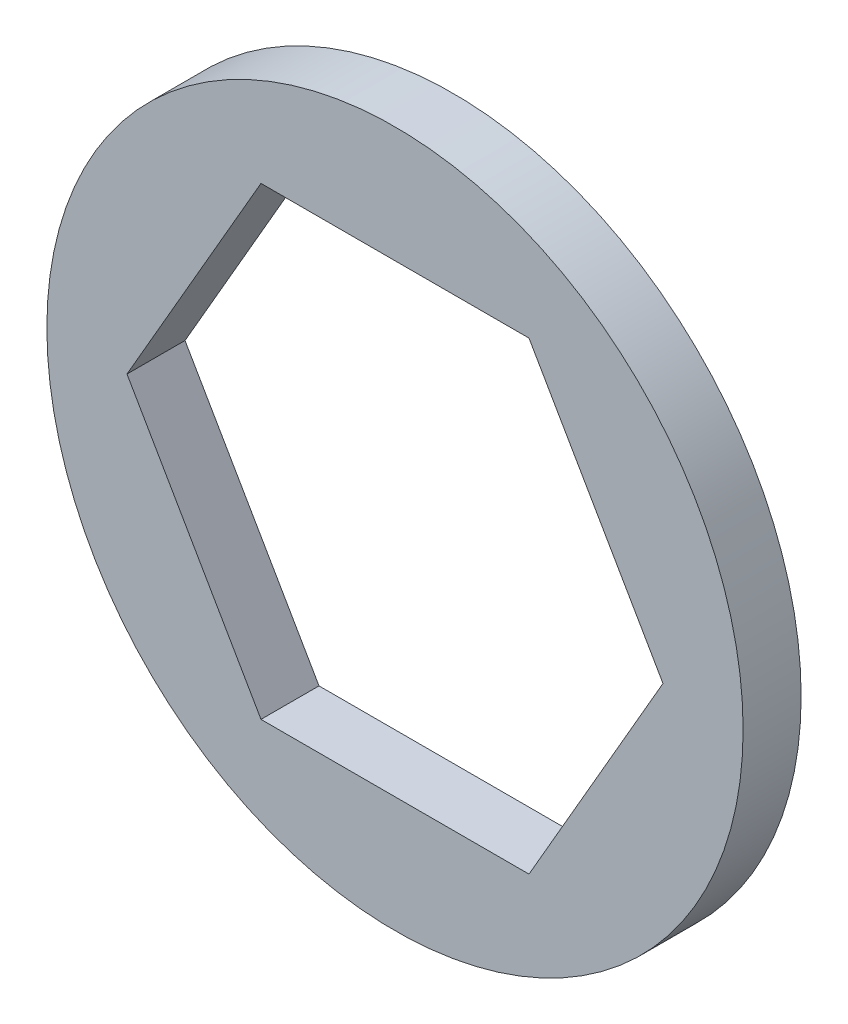
from build123d import *

# Parameters (mm, degrees)
SKETCH1_R           = 9.525
BOSS_EXTRUDE1_DEPTH = 1.5875


with BuildPart() as part:
    # Sketch1 → Boss-Extrude1 (new body)
    with BuildSketch(Plane.XY):
        Circle(SKETCH1_R)
        Polygon((3.666174209, 6.35), (-3.666174209, 6.35), (-7.332348419, 0), (-3.666174209, -6.35), (3.666174209, -6.35), (7.332348419, 0), align=None, mode=Mode.SUBTRACT)
    extrude(amount=BOSS_EXTRUDE1_DEPTH)


solid = part.part
